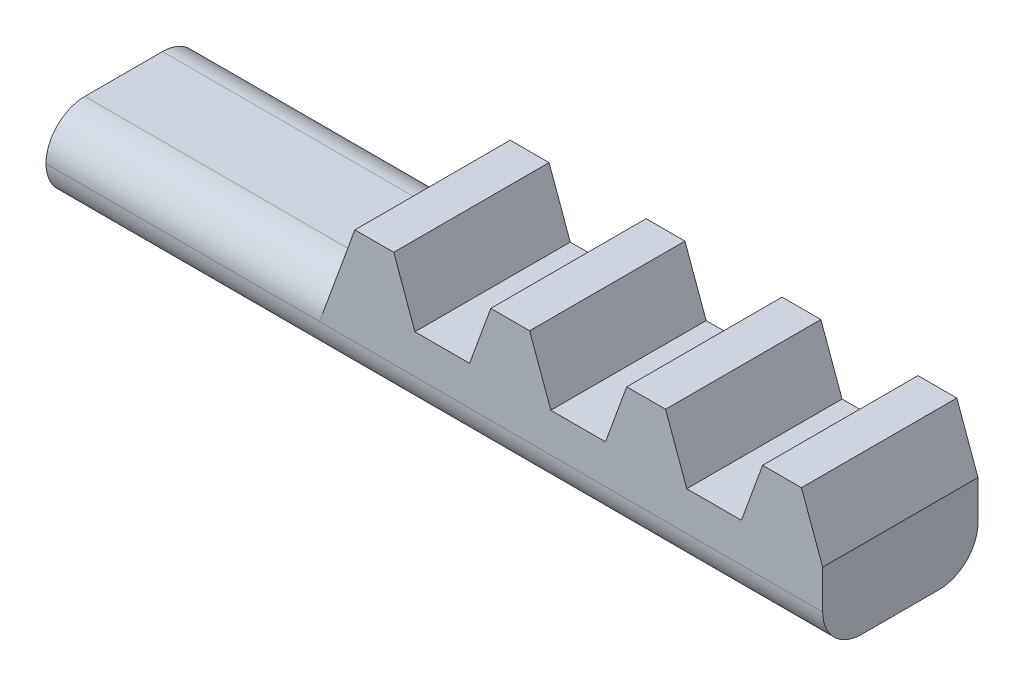
from build123d import *

# Parameters (mm, degrees)
BOSS_EXTRUDE1_DEPTH = 4
FILLET1_R           = 1


with BuildPart() as part:
    # Sketch1 → Boss-Extrude1 (new body)
    with BuildSketch(Plane.XY):
        Polygon((6.5, 1), (7.908089297, 1), (8.454044649, 2.5), (9.454044649, 2.5), (10, 1), (10, -1), (-10, -1), (-10, 1), (-2.591910703, 1), (-2.045955351, 2.5), (-1.045955351, 2.5), (-0.5, 1), (0.908089297, 1), (1.454044649, 2.5), (2.454044649, 2.5), (3, 1), (4.408089297, 1), (4.954044649, 2.5), (5.954044649, 2.5), align=None)
    extrude(amount=BOSS_EXTRUDE1_DEPTH)

    # Fillet1
    fillet1_edges = [part.edges().sort_by_distance(p)[0] for p in [
        (0, -1, 4),
        (0, -1, 0),
        (-6.295955351, 1, 0),
        (-6.295955351, 1, 4),
    ]]
    fillet(fillet1_edges, radius=FILLET1_R - 0.0001)  # a hair under: the kernel refuses the full size


solid = part.part
